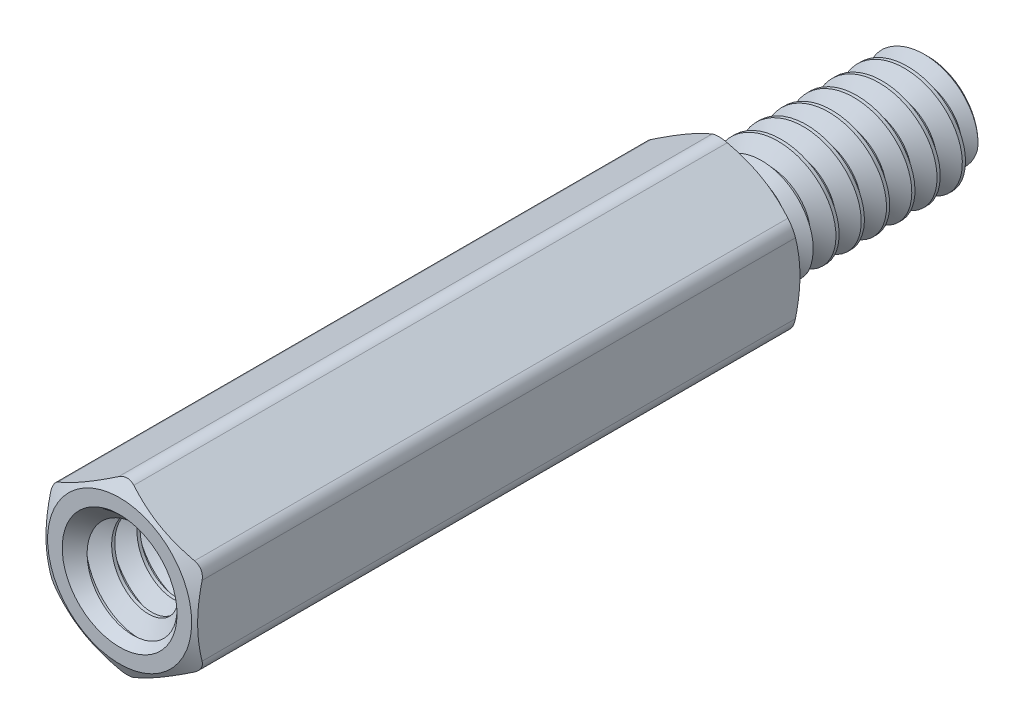
from build123d import *

# Parameters (mm, degrees)
SKETCH4_R              = 2.066925
BOSS_EXTRUDE1_DEPTH    = 19.05
SKETCH5_OUTSIDE_W      = 104.396
SKETCH5_OUTSIDE_H      = 105.134
SKETCH5_OUTSIDE_R      = 2.2621875
CUT_EXTRUDE1_DEPTH     = 26.659127427
CUT_EXTRUDE1_DRAFT     = -60
SKETCH6_OUTSIDE_W      = 82.694
SKETCH6_OUTSIDE_H      = 83.432
SKETCH6_OUTSIDE_R      = 2.2621875
CUT_EXTRUDE2_DEPTH     = 20.39415686
CUT_EXTRUDE2_DRAFT     = -60
FILLET1_R              = 0.47625
CUT_SWEEP1_PITCH       = 0.79375
CUT_SWEEP1_HEIGHT      = 6.1595
CUT_SWEEP1_RADIUS      = 1.7526
CUT_SWEEP1_START_ANGLE = 90
SKETCH9_R              = 1.9510375
BOSS_EXTRUDE2_DEPTH    = 9.525
SKETCH10_W             = 9.525
SKETCH10_H             = 1.7526
CUT_SWEEP2_PITCH       = 0.79375
CUT_SWEEP2_HEIGHT      = 10.31875
CUT_SWEEP2_RADIUS      = 1.7526
CUT_SWEEP2_START_ANGLE = 90


with BuildPart() as part:
    # Sketch3 → Revolve1 (revolve)
    with BuildSketch(Plane(origin=(0, 0, 0), x_dir=(0, 0, -1), z_dir=(1, 0, 0))):
        with BuildLine():
            Line((-9.525, 1.5541625), (-9.525, 0))
            Line((-9.525, 0), (6.35, 0))
            Line((6.35, 0), (6.35, 1.5541625))
            Line((6.35, 1.5541625), (6.1515625, 1.7526))
            Line((6.1515625, 1.7526), (1.05965625, 1.7526))
            Line((1.05965625, 1.7526), (0.762, 1.237044252))
            Line((0.762, 1.237044252), (0.1984375, 1.237044252))
            ThreePointArc((0.1984375, 1.237044252), (0.058120998, 1.29516525), (0, 1.435481752))
            Line((0, 1.435481752), (0, 2.38125))
            Line((0, 2.38125), (-19.05, 2.38125))
            Line((-19.05, 2.38125), (-19.05, 1.9510375))
            Line((-19.05, 1.9510375), (-18.8515625, 1.7526))
            Line((-18.8515625, 1.7526), (-9.7234375, 1.7526))
            Line((-9.7234375, 1.7526), (-9.525, 1.5541625))
        make_face()
    revolve(axis=Axis((0, 0, -6.35), (0, 0, 1)))

    # Sketch4 → Boss-Extrude1 (add)
    with BuildSketch(Plane.XY.offset(19.05)):
        Polygon((-2.38125, 1.374815329), (-2.38125, -1.374815329), (0, -2.749630657), (2.38125, -1.374815329), (2.38125, 1.374815329), (0, 2.749630657), align=None)
        Circle(SKETCH4_R, mode=Mode.SUBTRACT)
    extrude(amount=-BOSS_EXTRUDE1_DEPTH)


with BuildPart() as cut_extrude1_tool:
    # Sketch5 outside → Cut-Extrude1 (with draft: the straight prism first)
    with BuildSketch(Plane.XY.offset(19.05)):
        Rectangle(SKETCH5_OUTSIDE_W, SKETCH5_OUTSIDE_H)
        Circle(SKETCH5_OUTSIDE_R, mode=Mode.SUBTRACT)
    extrude(amount=-CUT_EXTRUDE1_DEPTH)
    # Cut-Extrude1: the draft: its side faces are tilted about the plane it starts from
    cut_extrude1_sides = [cut_extrude1_tool.faces().sort_by_distance(p)[0] for p in [
        (0, -52.567, 5.720436287),
        (52.198, 0, 5.720436287),
        (0, 52.567, 5.720436287),
        (-52.198, 0, 5.720436287),
        (-2.2621875, 0, 5.720436287),
    ]]
    draft(cut_extrude1_sides, Plane.XY.offset(19.05), CUT_EXTRUDE1_DRAFT)


with BuildPart() as part_1:
    add(part.part)

    # Cut-Extrude1: cut by cut_extrude1_tool
    add(cut_extrude1_tool.part, mode=Mode.SUBTRACT)


with BuildPart() as cut_extrude2_tool:
    # Sketch6 outside → Cut-Extrude2 (with draft: the straight prism first)
    with BuildSketch(Plane(origin=(0, 0, 0), x_dir=(-1, 0, 0), z_dir=(0, 0, -1))):
        Rectangle(SKETCH6_OUTSIDE_W, SKETCH6_OUTSIDE_H)
        Circle(SKETCH6_OUTSIDE_R, mode=Mode.SUBTRACT)
    extrude(amount=-CUT_EXTRUDE2_DEPTH)
    # Cut-Extrude2: the draft: its side faces are tilted about the plane it starts from
    cut_extrude2_sides = [cut_extrude2_tool.faces().sort_by_distance(p)[0] for p in [
        (0, -41.716, 10.19707843),
        (-41.347, 0, 10.19707843),
        (0, 41.716, 10.19707843),
        (41.347, 0, 10.19707843),
        (2.2621875, 0, 10.19707843),
    ]]
    draft(cut_extrude2_sides, Plane(origin=(0, 0, 0), x_dir=(-1, 0, 0), z_dir=(0, 0, -1)), CUT_EXTRUDE2_DRAFT)


with BuildPart() as part_2:
    add(part_1.part)

    # Cut-Extrude2: cut by cut_extrude2_tool
    add(cut_extrude2_tool.part, mode=Mode.SUBTRACT)

    # Fillet1
    fillet1_edges = [part_2.edges().sort_by_distance(p)[0] for p in [
        (0, 2.749630657, 9.525),
        (-2.38125, -1.374815329, 9.525),
        (0, -2.749630657, 9.525),
        (2.38125, -1.374815329, 9.525),
        (2.38125, 1.374815329, 9.525),
        (-2.38125, 1.374815329, 9.525),
    ]]
    fillet(fillet1_edges, radius=FILLET1_R)

    # Cut-Sweep1: sweep along a helix
    with BuildLine() as cut_sweep1_path:
        add(Helix(CUT_SWEEP1_PITCH, CUT_SWEEP1_HEIGHT, CUT_SWEEP1_RADIUS, center=(0, 0, -6.35), direction=(0, 0, 1), mode=Mode.PRIVATE).rotate(Axis((0, 0, -6.35), (0, 0, 1)), CUT_SWEEP1_START_ANGLE))
    # Sketch7 → Cut-Sweep1 (sweep, cut)
    with BuildSketch(Plane.ZY):
        Polygon((-6.64765625, 1.237044252), (-6.746875, 1.237044252), (-7.069335938, 1.795562979), (-6.325195312, 1.795562979), align=None)
    sweep(path=cut_sweep1_path.line, is_frenet=True, mode=Mode.SUBTRACT)

    # Sketch9 → Boss-Extrude2 (add)
    with BuildSketch(Plane.XY.offset(9.525)):
        Circle(SKETCH9_R)
    extrude(amount=BOSS_EXTRUDE2_DEPTH)


with BuildPart() as body_2:
    # Sketch10 → Revolve2 (revolve)
    with BuildSketch(Plane(origin=(0, 0, 0), x_dir=(0, 0, -1), z_dir=(1, 0, 0))):
        with Locations((-14.2875, 0.8763)):
            Rectangle(SKETCH10_W, SKETCH10_H)
    revolve(axis=Axis((0, 0, -6.35), (0, 0, 1)))

    # Cut-Sweep2: sweep along a helix
    with BuildLine() as cut_sweep2_path:
        add(Helix(CUT_SWEEP2_PITCH, CUT_SWEEP2_HEIGHT, CUT_SWEEP2_RADIUS, center=(0, 0, 19.05), direction=(0, 0, -1), mode=Mode.PRIVATE).rotate(Axis((0, 0, 19.05), (0, 0, -1)), CUT_SWEEP2_START_ANGLE))
    # Sketch12 → Cut-Sweep2 (sweep, cut)
    with BuildSketch(Plane(origin=(0, 0, 0), x_dir=(0, 0, -1), z_dir=(1, 0, 0))):
        Polygon((-19.446875, 1.237044252), (-19.34765625, 1.237044252), (-19.025195313, 1.795562979), (-19.769335938, 1.795562979), align=None)
    sweep(path=cut_sweep2_path.line, is_frenet=True, mode=Mode.SUBTRACT)


with BuildPart() as part_3:
    add(part_2.part)

    # Combine1: cut body 2
    add(body_2.part, mode=Mode.SUBTRACT)

    # Cut-Extrude3 cone 1 section (through the dimple's axis) → Cut-Extrude3 (revolve, cut)
    with BuildSketch(Plane(origin=(0, 0, 19.05), x_dir=(0, -1, 0), z_dir=(1, 0, 0))):
        Polygon((0, 0), (1.8034, 0), (0, 1.8034), align=None)
    revolve(axis=Axis((0, 0, 19.05), (0, 0, -1)), mode=Mode.SUBTRACT)


solid = part_3.part
